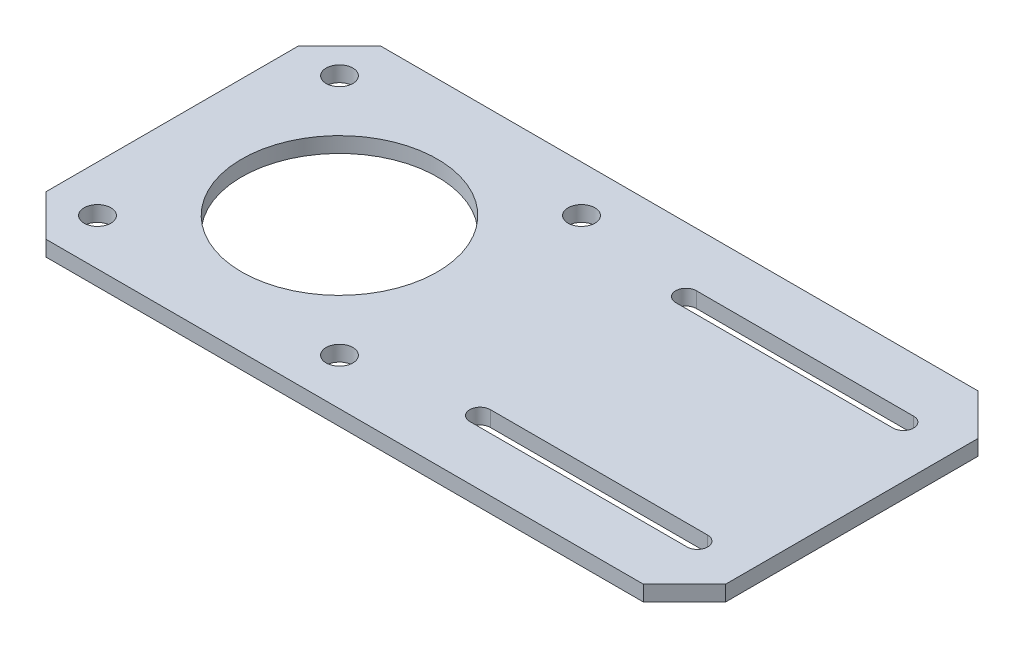
from build123d import *

# Parameters (mm, degrees)
SKETCH1_W             = 132
SKETCH1_H             = 65
MAIN_PLATE_BODY_DEPTH = 3
CHAMFER1_SIZE         = 8
MAIN_MOTOR_HOLE_R     = 19
MAIN_MOTOR_HOLE_R_2   = 2.6
MOTOR_HOLES_DEPTH     = 148.166572291
MOUNTING_SLOTS_DEPTH  = 148.166572291


with BuildPart() as part:
    # Sketch1 → Main Plate Body (new body)
    with BuildSketch(Plane(origin=(0, 0, 0), x_dir=(1, 0, 0), z_dir=(0, 1, 0))):
        with Locations((66, -32.5)):
            Rectangle(SKETCH1_W, SKETCH1_H)
    extrude(amount=MAIN_PLATE_BODY_DEPTH)

    # Chamfer1
    chamfer1_edges = [part.edges().sort_by_distance(p)[0] for p in [
        (0, 1.5, 65),
        (0, 1.5, 0),
        (132, 1.5, 0),
        (132, 1.5, 65),
    ]]
    chamfer(chamfer1_edges, length=CHAMFER1_SIZE)

    # Main Motor Hole → Motor Holes (cut, through all)
    with BuildSketch(Plane(origin=(0, 3, 0), x_dir=(1, 0, 0), z_dir=(0, 1, 0))):
        with Locations((32.5, -32.5)):
            Circle(MAIN_MOTOR_HOLE_R)
        with Locations((9, -56)):
            Circle(MAIN_MOTOR_HOLE_R_2)
        with Locations((56, -56)):
            Circle(MAIN_MOTOR_HOLE_R_2)
        with Locations((56, -9)):
            Circle(MAIN_MOTOR_HOLE_R_2)
        with Locations((9, -9)):
            Circle(MAIN_MOTOR_HOLE_R_2)
    extrude(amount=-MOTOR_HOLES_DEPTH, mode=Mode.SUBTRACT)

    # T-Slot Mounting Slots → Mounting Slots (cut, through all)
    with BuildSketch(Plane(origin=(0, 3, 0), x_dir=(1, 0, 0), z_dir=(0, 1, 0))):
        with BuildLine():
            Line((122, -50.5), (79.8, -50.5))
            ThreePointArc((79.8, -50.5), (77.8, -52.5), (79.8, -54.5))
            Line((79.8, -54.5), (122, -54.5))
            ThreePointArc((122, -54.5), (124, -52.5), (122, -50.5))
        make_face()
        with BuildLine():
            Line((122, -10.5), (79.8, -10.5))
            ThreePointArc((79.8, -10.5), (77.8, -12.5), (79.8, -14.5))
            Line((79.8, -14.5), (122, -14.5))
            ThreePointArc((122, -14.5), (124, -12.5), (122, -10.5))
        make_face()
    extrude(amount=-MOUNTING_SLOTS_DEPTH, mode=Mode.SUBTRACT)


solid = part.part
